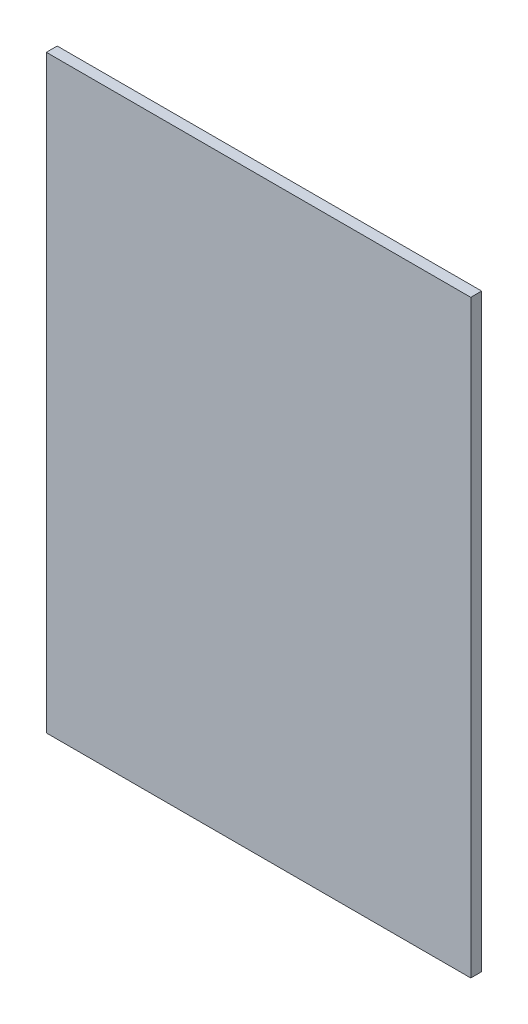
from build123d import *

# Parameters (mm, degrees)
SKETCH1_W           = 1170
SKETCH1_H           = 1625
BOSS_EXTRUDE1_DEPTH = 30


with BuildPart() as part:
    # Sketch1 → Boss-Extrude1 (new body)
    with BuildSketch(Plane.XY):
        with Locations((585, 812.5)):
            Rectangle(SKETCH1_W, SKETCH1_H)
    extrude(amount=BOSS_EXTRUDE1_DEPTH)


solid = part.part
